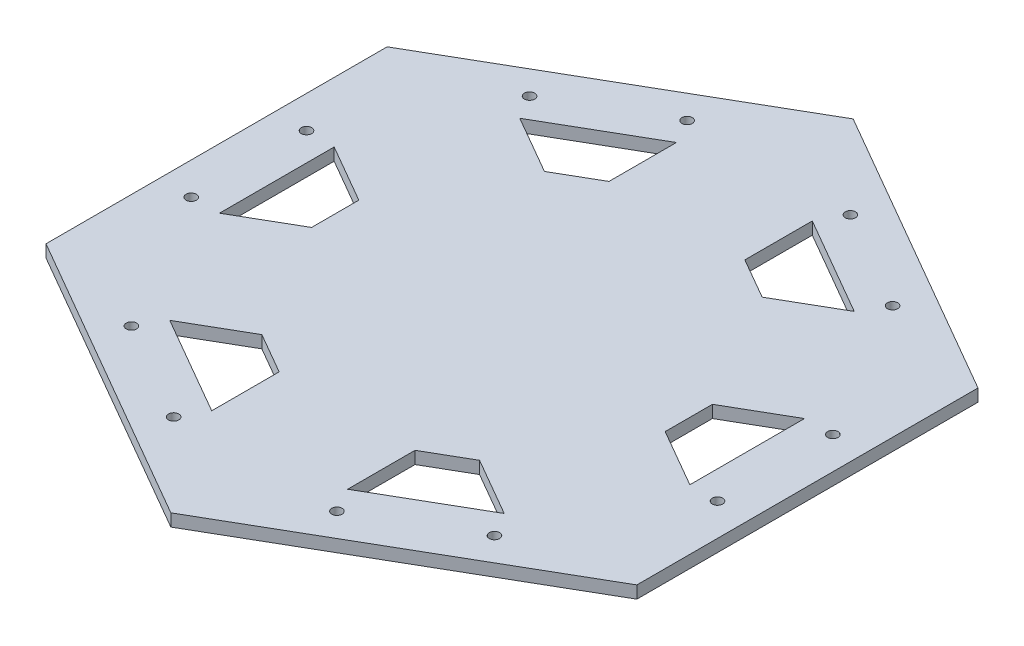
from build123d import *

# Parameters (mm, degrees)
BOSS_EXTRUDE1_DEPTH              = 4.25
CUT_EXTRUDE1_DEPTH               = 4.25
F_37_0_14015748_DIAMETER_HOLE1_D = 3.559999992


with BuildPart() as part:
    # Sketch2 → Boss-Extrude1 (new body)
    with BuildSketch(Plane(origin=(0, 0, 0), x_dir=(1, 0, 0), z_dir=(0, 1, 0))):
        Polygon((0, -117.317574699), (101.6, -58.65878735), (101.6, 58.65878735), (0, 117.317574699), (-101.6, 58.65878735), (-101.6, -58.65878735), align=None)
    extrude(amount=BOSS_EXTRUDE1_DEPTH)

    # Sketch3 → Cut-Extrude1 (cut)
    with BuildSketch(Plane(origin=(0, 4.25, 0), x_dir=(1, 0, 0), z_dir=(0, 1, 0))):
        Polygon((-80.88, 19.716547651), (-80.88, -19.716547651), (-60.8, -8.123354245), (-60.8, 8.123354245), align=None)
        Polygon((-37.43503114, 48.592667427), (-23.36496886, 56.716021673), (-23.36496886, 79.902408483), (-57.51503114, 60.185860833), align=None)
        Polygon((23.36496886, 56.716021673), (37.43503114, 48.592667427), (57.51503114, 60.185860833), (23.36496886, 79.902408483), align=None)
        Polygon((60.8, 8.123354245), (60.8, -8.123354245), (80.88, -19.716547651), (80.88, 19.716547651), align=None)
        Polygon((37.43503114, -48.592667427), (23.36496886, -56.716021673), (23.36496886, -79.902408483), (57.51503114, -60.185860833), align=None)
        Polygon((-23.36496886, -56.716021673), (-37.43503114, -48.592667427), (-57.51503114, -60.185860833), (-23.36496886, -79.902408483), align=None)
    extrude(amount=-CUT_EXTRUDE1_DEPTH, mode=Mode.SUBTRACT)

    # #37 (0.14015748) Diameter Hole1 (through all)
    with Locations(Plane(origin=(0, 4.25, 0), x_dir=(1, 0, 0), z_dir=(0, 1, 0))):
        with Locations((62.423283757, 68.460299042), (90.5, 19.83), (90.5, -19.83), (62.423283757, -68.460299042), (28.076716243, -88.290299042), (-28.076716243, -88.290299042), (-62.423283757, -68.460299042), (-90.5, -19.83), (-90.5, 19.83), (-62.423283757, 68.460299042), (-28.076716243, 88.290299042), (28.076716243, 88.290299042)):
            Hole(F_37_0_14015748_DIAMETER_HOLE1_D / 2)


solid = part.part
